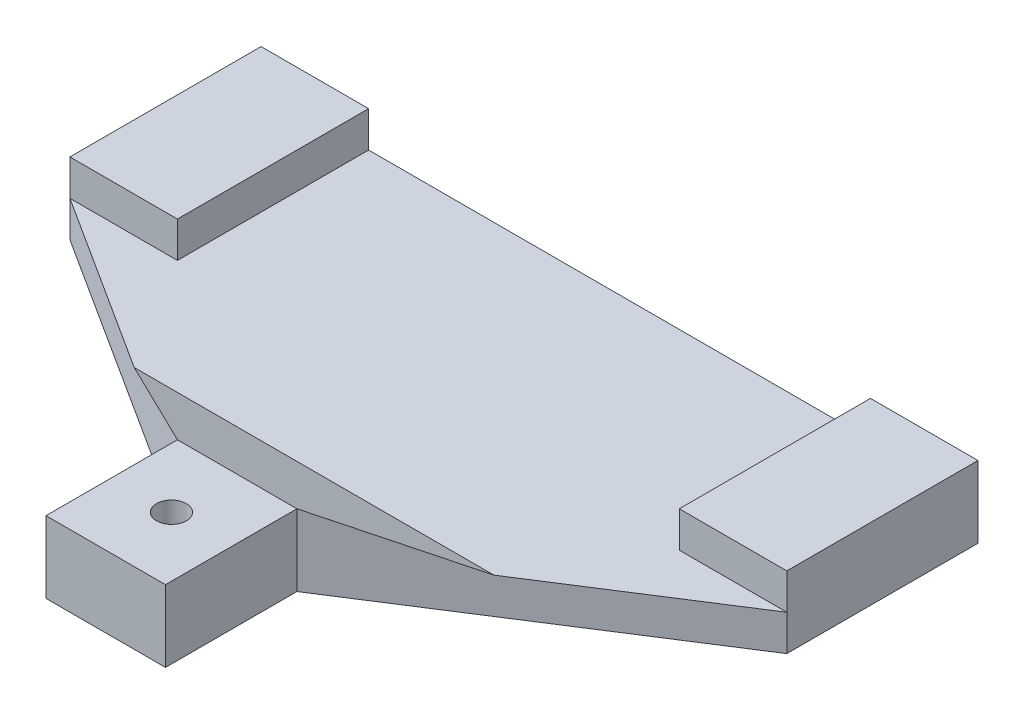
from build123d import *

# Parameters (mm, degrees)
ESQUISSE1_W             = 60
ESQUISSE1_H             = 6
BOSS_EXTRU_1_DEPTH      = 60
ESQUISSE2_R             = 1.25
ENL_V_MAT_EXTRU_1_DEPTH = 15
ESQUISSE3_R             = 1.25
ENL_V_MAT_EXTRU_2_DEPTH = 15
ESQUISSE4_W             = 10
ESQUISSE4_H             = 11
ENL_V_MAT_EXTRU_3_DEPTH = 3
ENL_V_MAT_EXTRU_4_DEPTH = 52
CHANFREIN1_SIZE2        = 6.433520762
CHANFREIN1_SIZE         = 3


with BuildPart() as part:
    # Esquisse1 → Boss.-Extru.1 (new body)
    with BuildSketch(Plane.XY):
        with Locations((30, 3)):
            Rectangle(ESQUISSE1_W, ESQUISSE1_H)
    extrude(amount=BOSS_EXTRU_1_DEPTH)

    # Esquisse2 → Enlèv. mat.-Extru.1 (cut)
    with BuildSketch(Plane(origin=(0, 0, 0), x_dir=(-1, 0, 0), z_dir=(0, 0, -1))):
        with Locations((-54, 3)):
            Circle(ESQUISSE2_R)
        with Locations((-5.75, 3)):
            Circle(ESQUISSE2_R)
    extrude(amount=-ENL_V_MAT_EXTRU_1_DEPTH, mode=Mode.SUBTRACT)

    # Esquisse3 → Enlèv. mat.-Extru.2 (cut)
    with BuildSketch(Plane(origin=(0, 6, 0), x_dir=(1, 0, 0), z_dir=(0, 1, 0))):
        with Locations(Location((30, -37.5, 0), (0, 0, 270))):
            Circle(ESQUISSE3_R)
    extrude(amount=-ENL_V_MAT_EXTRU_2_DEPTH, mode=Mode.SUBTRACT)

    # Esquisse4 → Enlèv. mat.-Extru.3 (cut)
    with BuildSketch(Plane(origin=(0, 6, 0), x_dir=(1, 0, 0), z_dir=(0, 1, 0))):
        Polygon((0, -16), (9, -16), (9, 0), (51, 0), (51, -16), (60, -16), (60, -60), (0, -60), align=None)
        with Locations((30, -37.5)):
            Rectangle(ESQUISSE4_W, ESQUISSE4_H, mode=Mode.SUBTRACT)
    extrude(amount=-ENL_V_MAT_EXTRU_3_DEPTH, mode=Mode.SUBTRACT)

    # Esquisse5 → Enlèv. mat.-Extru.4 (cut)
    with BuildSketch(Plane(origin=(0, 3, 0), x_dir=(1, 0, 0), z_dir=(0, 1, 0))):
        Polygon((60, -16), (35, -32), (35, -43), (25, -43), (25, -32), (0, -16), (-21.594855386, -85.475485762), (75.414479662, -69.930764824), align=None)
    extrude(amount=-ENL_V_MAT_EXTRU_4_DEPTH, mode=Mode.SUBTRACT)

    # Chanfrein1
    chanfrein1_edges = [part.edges().sort_by_distance(p)[0] for p in [
        (30, 3, 32),
    ]]
    chanfrein1_side = [part.faces().sort_by_distance(p)[0] for p in [
        (30, 3.06, 32),
    ]]
    chamfer(chanfrein1_edges, length=CHANFREIN1_SIZE - 0.0001, length2=CHANFREIN1_SIZE2 - 0.0001, reference=chanfrein1_side[0])  # a hair under: the kernel refuses the full size


solid = part.part
